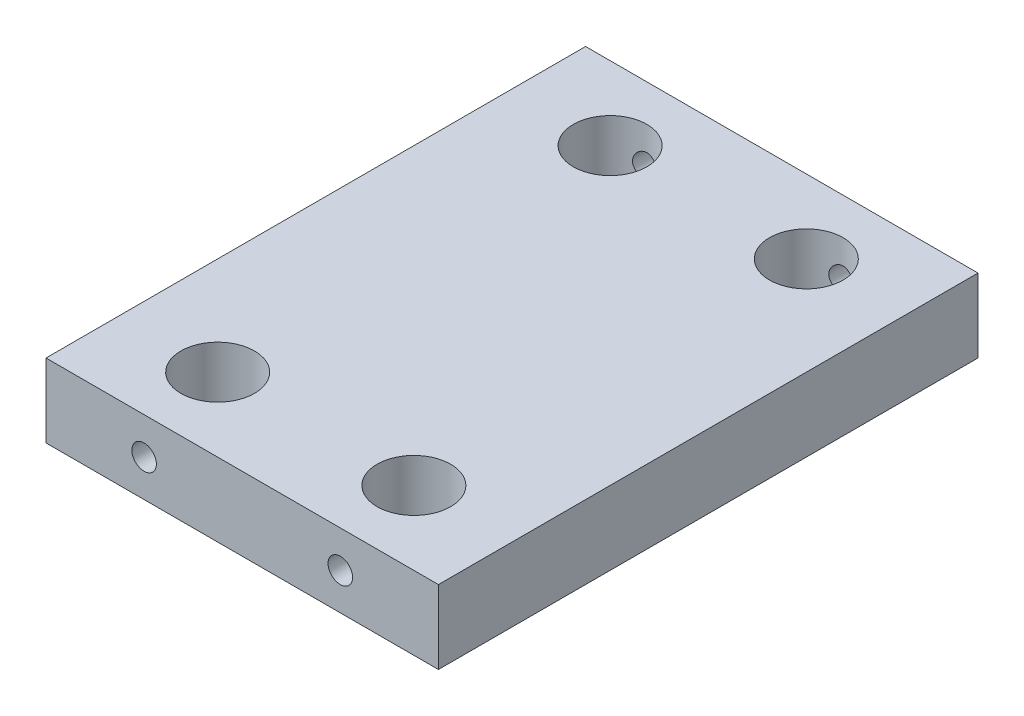
from build123d import *

# Parameters (mm, degrees)
SKETCH1_W           = 101.6
SKETCH1_H           = 139.7
BOSS_EXTRUDE1_DEPTH = 19.05


with BuildPart() as part:
    # Sketch1 → Boss-Extrude1 (new body)
    with BuildSketch(Plane(origin=(0, 0, 0), x_dir=(1, 0, 0), z_dir=(0, 1, 0))):
        Rectangle(SKETCH1_W, SKETCH1_H)
    extrude(amount=BOSS_EXTRUDE1_DEPTH)

    # Sketch2 → 3/4 (0.75) Diameter Hole1 (revolve, cut)
    with BuildSketch(Plane(origin=(-25.4, 19.05, -50.8), x_dir=(0, 0, 1), z_dir=(1, 0, 0))):
        Polygon((0, 0), (0, 24.773197396), (9.525, 19.05), (9.525, 0), align=None)
    f_3_4_0_75_diameter_hole1 = revolve(axis=Axis((-25.4, 25.4, -50.8), (0, -1, 0)), mode=Mode.SUBTRACT)

    # Mirror1: 3/4 (0.75) Diameter Hole1 across plane
    add(f_3_4_0_75_diameter_hole1.mirror(Plane.XY), mode=Mode.SUBTRACT)

    # Mirror4: 3/4 (0.75) Diameter Hole1 across plane
    add(f_3_4_0_75_diameter_hole1.mirror(Plane(origin=(0, 0, 0), x_dir=(0, 0, 1), z_dir=(1, 0, 0))), mode=Mode.SUBTRACT)

    # Mirror4 copy 1 sketch → Mirror4 copy 1 (revolve, cut)
    with BuildSketch(Plane(origin=(25.4, 19.05, 50.8), x_dir=(0, 0, -1), z_dir=(-1, 0, 0))):
        Polygon((0, 0), (0, 24.773197396), (9.525, 19.05), (9.525, 0), align=None)
    revolve(axis=Axis((25.4, 25.4, 50.8), (0, -1, 0)), mode=Mode.SUBTRACT)

    # Sketch4 → 1/4 (0.25) Diameter Hole1 (revolve, cut)
    with BuildSketch(Plane(origin=(25.4, 9.525, -69.85), x_dir=(0, 1, 0), z_dir=(1, 0, 0))):
        Polygon((0, 0), (0, 20.957732465), (3.175, 19.05), (3.175, 0), align=None)
    f_1_4_0_25_diameter_hole1 = revolve(axis=Axis((25.4, 9.525, -76.2), (0, 0, 1)), mode=Mode.SUBTRACT)

    # Mirror5: 1/4 (0.25) Diameter Hole1 across plane
    add(f_1_4_0_25_diameter_hole1.mirror(Plane.XY), mode=Mode.SUBTRACT)

    # Mirror10 copy 1 sketch → Mirror10 copy 1 (revolve, cut)
    with BuildSketch(Plane(origin=(-25.4, 9.525, 69.85), x_dir=(0, 1, 0), z_dir=(-1, 0, 0))):
        Polygon((0, 0), (0, 20.957732465), (3.175, 19.05), (3.175, 0), align=None)
    revolve(axis=Axis((-25.4, 9.525, 76.2), (0, 0, -1)), mode=Mode.SUBTRACT)

    # Mirror10 copy 2 sketch → Mirror10 copy 2 (revolve, cut)
    with BuildSketch(Plane(origin=(-25.4, 9.525, -69.85), x_dir=(0, 1, 0), z_dir=(-1, 0, 0))):
        Polygon((0, 0), (0, -20.957732465), (3.175, -19.05), (3.175, 0), align=None)
    revolve(axis=Axis((-25.4, 9.525, -76.2), (0, 0, -1)), mode=Mode.SUBTRACT)


solid = part.part
